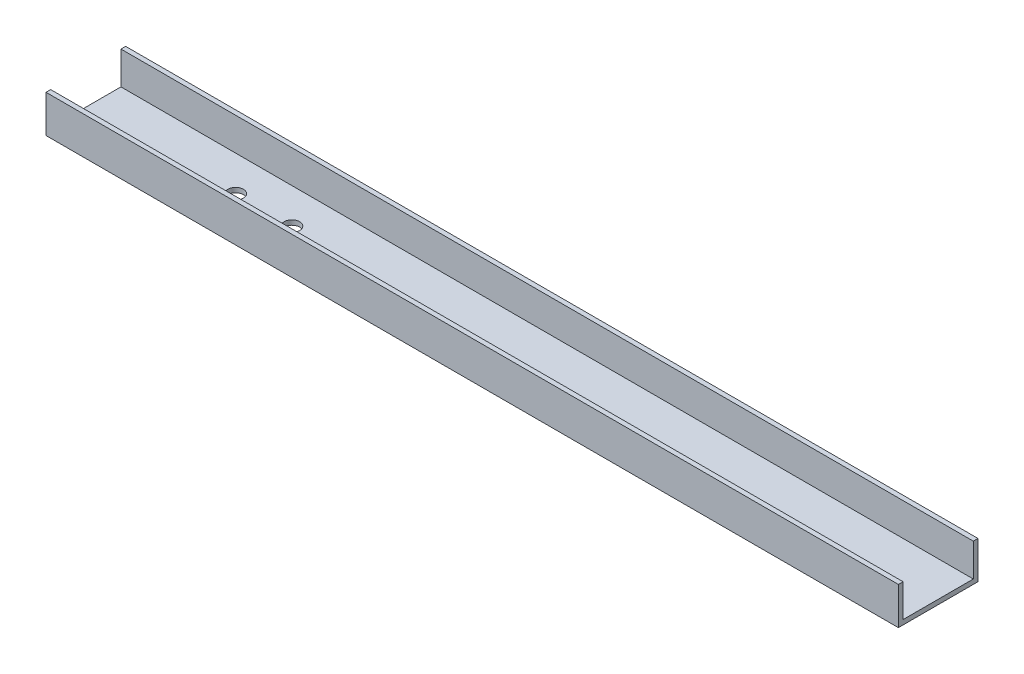
from build123d import *

# Parameters (mm, degrees)
SKETCH1_W               = 182
SKETCH1_H               = 17
BOSS_EXTRUDE1_DEPTH     = 1
SKETCH8_W               = 182
SKETCH8_H               = 1
BOSS_EXTRUDE2_DEPTH     = 7
ADVANCEDHOLE1_OUTLINE_R = 1.65
ADVANCEDHOLE1_DEPTH     = 1
SKETCH12_W              = 182
SKETCH12_H              = 13
SKETCH12_R              = 2
BOSS_EXTRUDE3_DEPTH     = 1
SKETCH13_W              = 182
SKETCH13_H              = 1
BOSS_EXTRUDE4_DEPTH     = 3


# Read off the part's stored shape, not the designer's step: AdvancedHole1
with BuildPart() as part:
    # Sketch1 → Boss-Extrude1 (new body)
    with BuildSketch(Plane(origin=(0, 0, 0), x_dir=(1, 0, 0), z_dir=(0, 1, 0))):
        Rectangle(SKETCH1_W, SKETCH1_H)
    extrude(amount=BOSS_EXTRUDE1_DEPTH)

    # Sketch8 → Boss-Extrude2 (add)
    with BuildSketch(Plane(origin=(0, 1, 0), x_dir=(1, 0, 0), z_dir=(0, 1, 0))):
        with Locations((0, 8)):
            Rectangle(SKETCH8_W, SKETCH8_H)
        with Locations((0, -8)):
            Rectangle(SKETCH8_W, SKETCH8_H)
    extrude(amount=BOSS_EXTRUDE2_DEPTH)

    # AdvancedHole1 outline → AdvancedHole1 (cut)
    with BuildSketch(Plane(origin=(0, 0, 0), x_dir=(1, 0, 0), z_dir=(0, 1, 0))):
        with Locations((-47, 0)):
            Circle(ADVANCEDHOLE1_OUTLINE_R)
        with Locations((-59, 0)):
            Circle(ADVANCEDHOLE1_OUTLINE_R)
    extrude(amount=ADVANCEDHOLE1_DEPTH, mode=Mode.SUBTRACT)


with BuildPart() as body_2:
    # Sketch12 → Boss-Extrude3 (new body)
    with BuildSketch(Plane(origin=(0, 0, 0), x_dir=(1, 0, 0), z_dir=(0, 1, 0))):
        with Locations((0, 44.153691451)):
            Rectangle(SKETCH12_W, SKETCH12_H)
        with Locations(Location((-72, 44.153691451, 0), (0, 0, 270))):
            Circle(SKETCH12_R, mode=Mode.SUBTRACT)
        with Locations(Location((-64, 44.153691451, 0), (0, 0, 270))):
            Circle(SKETCH12_R, mode=Mode.SUBTRACT)
        with Locations(Location((-56, 44.153691451, 0), (0, 0, 270))):
            Circle(SKETCH12_R, mode=Mode.SUBTRACT)
        with Locations(Location((-40, 44.153691451, 0), (0, 0, 270))):
            Circle(SKETCH12_R, mode=Mode.SUBTRACT)
        with Locations(Location((-32, 44.153691451, 0), (0, 0, 270))):
            Circle(SKETCH12_R, mode=Mode.SUBTRACT)
        with Locations(Location((-24, 44.153691451, 0), (0, 0, 270))):
            Circle(SKETCH12_R, mode=Mode.SUBTRACT)
        with Locations(Location((40, 44.153691451, 0), (0, 0, 90))):
            Circle(SKETCH12_R, mode=Mode.SUBTRACT)
        with Locations(Location((32, 44.153691451, 0), (0, 0, 90))):
            Circle(SKETCH12_R, mode=Mode.SUBTRACT)
        with Locations(Location((24, 44.153691451, 0), (0, 0, 90))):
            Circle(SKETCH12_R, mode=Mode.SUBTRACT)
        with Locations(Location((8, 44.153691451, 0), (0, 0, 90))):
            Circle(SKETCH12_R, mode=Mode.SUBTRACT)
        with Locations(Location((0, 44.153691451, 0), (0, 0, 90))):
            Circle(SKETCH12_R, mode=Mode.SUBTRACT)
        with Locations(Location((-8, 44.153691451, 0), (0, 0, 90))):
            Circle(SKETCH12_R, mode=Mode.SUBTRACT)
        with Locations(Location((72, 44.153691451, 0), (0, 0, 270))):
            Circle(SKETCH12_R, mode=Mode.SUBTRACT)
        with Locations(Location((64, 44.153691451, 0), (0, 0, 270))):
            Circle(SKETCH12_R, mode=Mode.SUBTRACT)
        with Locations(Location((56, 44.153691451, 0), (0, 0, 270))):
            Circle(SKETCH12_R, mode=Mode.SUBTRACT)
    extrude(amount=BOSS_EXTRUDE3_DEPTH)

    # Sketch13 → Boss-Extrude4 (add)
    with BuildSketch(Plane(origin=(0, 1, 0), x_dir=(1, 0, 0), z_dir=(0, 1, 0))):
        with Locations((0, 50.153691451)):
            Rectangle(SKETCH13_W, SKETCH13_H)
        with Locations((0, 38.153691451)):
            Rectangle(SKETCH13_W, SKETCH13_H)
    extrude(amount=BOSS_EXTRUDE4_DEPTH)


solid = part.part
